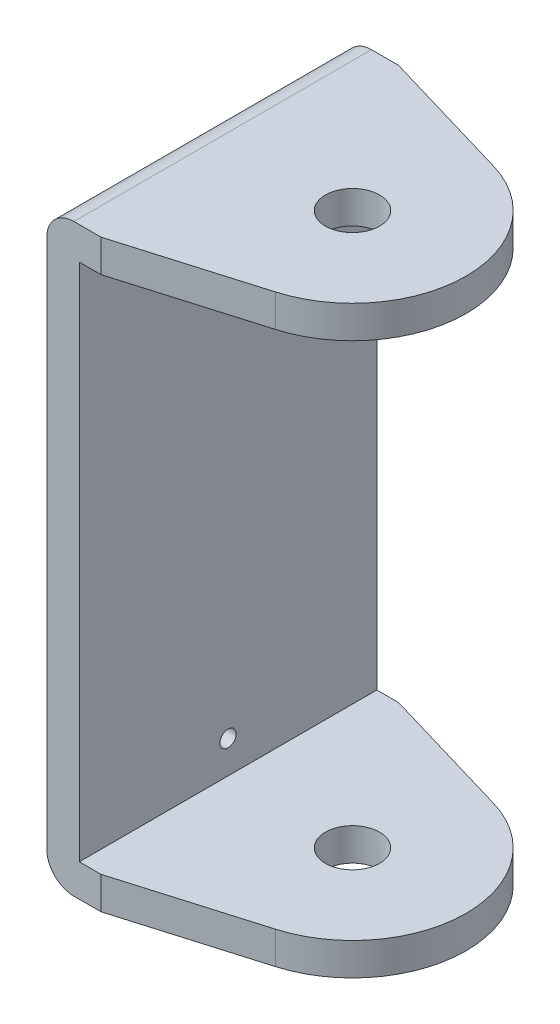
from build123d import *

# Parameters (mm, degrees)
EXTRUDE_1_DEPTH          = 27.5
SKETCH_9_R               = 5
CUT_EXTRUDE_2_DEPTH      = 136
CUT_EXTRUDE_3_DEPTH      = 123.148475226
CUT_EXTRUDE_3_DEPTH_BACK = 123.148475226
CUT_EXTRUDE_4_REACH      = 80.564
SKETCH_13_R              = 1.5


with BuildPart() as part:
    # 草圖1 → 填料-伸長1 (new, symmetric)
    with BuildSketch(Plane.XY):
        with BuildLine():
            Line((0, -54), (-45, -54))
            ThreePointArc((-45, -54), (-48.535533906, -52.535533906), (-50, -49))
            Line((-50, -49), (-50, 49))
            ThreePointArc((-50, 49), (-48.535533906, 52.535533906), (-45, 54))
            Line((-45, 54), (0, 54))
            Line((0, 54), (0, 48))
            Line((0, 48), (-44, 48))
            Line((-44, 48), (-44, -48))
            Line((-44, -48), (0, -48))
            Line((0, -48), (0, -54))
        make_face()
    extrude(amount=EXTRUDE_1_DEPTH, both=True)

    # 草圖9 → 除料-伸長2 (cut)
    with BuildSketch(Plane(origin=(0, 54, 0), x_dir=(1, 0, 0), z_dir=(0, 1, 0))):
        with Locations((-21, 0)):
            Circle(SKETCH_9_R)
    extrude(amount=-CUT_EXTRUDE_2_DEPTH, mode=Mode.SUBTRACT)

    # 草圖10 → 除料-伸長3 (cut, two sides: drawn at the far end of the back side and taken through both)
    with BuildSketch(Plane(origin=(0, 54, 0), x_dir=(1, 0, 0), z_dir=(0, 1, 0)).offset(-CUT_EXTRUDE_3_DEPTH_BACK)):
        with BuildLine():
            Line((-180.04752128, 68.815685703), (-40, 27.5))
            Line((-40, 27.5), (-15.057931362, 20.141792877))
            ThreePointArc((-15.057931362, 20.141792877), (0, 0), (-15.057931362, -20.141792877))
            Line((-15.057931362, -20.141792877), (-40, -27.5))
            Line((-40, -27.5), (-180.04752128, -68.815685703))
            Line((-180.04752128, -68.815685703), (111.981888895, -68.815685703))
            Line((111.981888895, -68.815685703), (111.981888895, 68.815685703))
            Line((111.981888895, 68.815685703), (-180.04752128, 68.815685703))
        make_face()
    extrude(amount=CUT_EXTRUDE_3_DEPTH + CUT_EXTRUDE_3_DEPTH_BACK, mode=Mode.SUBTRACT)

    # 草圖13 → 除料-伸長4 (cut, up to next)
    with BuildSketch(Plane.ZY.offset(50), mode=Mode.PRIVATE) as cut_extrude_4_sk1:
        with Locations((0, 42)):
            Circle(SKETCH_13_R)
    cut_extrude_4_tool1 = extrude(cut_extrude_4_sk1.sketch, amount=-CUT_EXTRUDE_4_REACH, mode=Mode.PRIVATE) & part.part
    # 草圖13 → 除料-伸長4 (cut, up to next)
    with BuildSketch(Plane.ZY.offset(50), mode=Mode.PRIVATE) as cut_extrude_4_sk2:
        with Locations((0, -42)):
            Circle(SKETCH_13_R)
    cut_extrude_4_tool2 = extrude(cut_extrude_4_sk2.sketch, amount=-CUT_EXTRUDE_4_REACH, mode=Mode.PRIVATE) & part.part
    add(cut_extrude_4_tool1.solids().sort_by_distance((-50, 42, 0))[0], mode=Mode.SUBTRACT)
    add(cut_extrude_4_tool2.solids().sort_by_distance((-50, -42, 0))[0], mode=Mode.SUBTRACT)


solid = part.part
